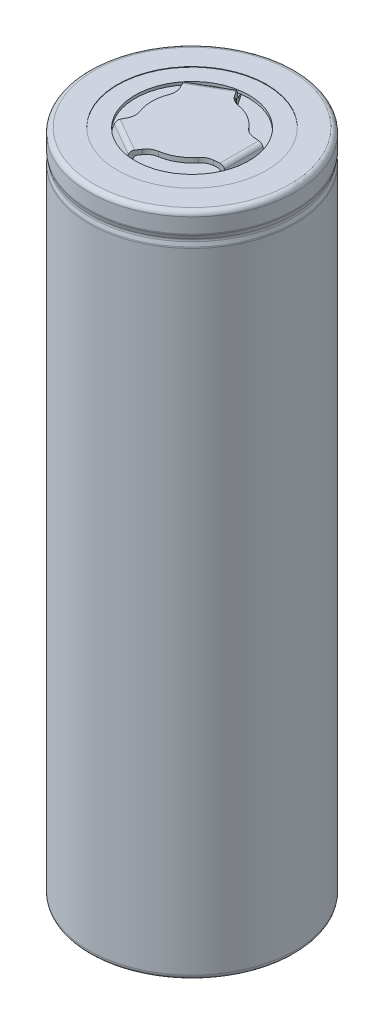
from build123d import *

# Parameters (mm, degrees)
SKETCH3_R           = 8
SKETCH3_R_2         = 6
BOSS_EXTRUDE1_DEPTH = 1
SKETCH5_R           = 4.25
BOSS_EXTRUDE3_DEPTH = 0.5
BOSS_EXTRUDE4_DEPTH = 1.75
BOSS_EXTRUDE5_START = 69.95
BOSS_EXTRUDE5_DEPTH = 0.5
DRAFT1_ANGLE        = 4
CIRPATTERN1_ANGLE   = 120
CIRPATTERN1_2_ANGLE = 120
FILLET1_R           = 1.5
SKETCH10_R          = 8
CUT_EXTRUDE1_DEPTH  = 0.7
SKETCH4_R           = 10.25
BOSS_EXTRUDE2_DEPTH = 68.7


with BuildPart() as part:
    # Sketch1 → Revolve1 (revolve)
    with BuildSketch(Plane.XY, mode=Mode.PRIVATE) as revolve1_sk:
        with BuildLine():
            Line((7.85, 70.2), (10.35, 70.2))
            ThreePointArc((10.35, 70.2), (10.703553391, 70.053553391), (10.85, 69.7))
            Line((10.85, 69.7), (10.85, 68.124220651))
            ThreePointArc((10.85, 68.124220651), (10.846117338, 68.062030724), (10.834529652, 68.000806647))
            Line((10.834529652, 68.000806647), (10.731434643, 67.596050404))
            ThreePointArc((10.731434643, 67.596050404), (10.715964295, 67.4726364), (10.731434643, 67.349222395))
            Line((10.731434643, 67.349222395), (10.834529652, 66.944466152))
            ThreePointArc((10.834529652, 66.944466152), (10.846117338, 66.883242075), (10.85, 66.821052148))
            Line((10.85, 66.821052148), (10.85, 0.5))
            ThreePointArc((10.85, 0.5), (10.703553391, 0.146446609), (10.35, 0))
            Line((10.35, 0), (8.5, 0))
            Line((8.5, 0), (8.5, 0.05))
            Line((8.5, 0.05), (10.35, 0.05))
            ThreePointArc((10.35, 0.05), (10.668198052, 0.181801948), (10.8, 0.5))
            Line((10.8, 0.5), (10.8, 66.821052148))
            ThreePointArc((10.8, 66.821052148), (10.796505604, 66.877023082), (10.786076687, 66.932124752))
            Line((10.786076687, 66.932124752), (10.682981678, 67.336880994))
            ThreePointArc((10.682981678, 67.336880994), (10.665964295, 67.4726364), (10.682981678, 67.608391805))
            Line((10.682981678, 67.608391805), (10.786076687, 68.013148047))
            ThreePointArc((10.786076687, 68.013148047), (10.796505604, 68.068249717), (10.8, 68.124220651))
            Line((10.8, 68.124220651), (10.8, 69.7))
            ThreePointArc((10.8, 69.7), (10.668198052, 70.018198052), (10.35, 70.15))
            Line((10.35, 70.15), (7.85, 70.15))
            Line((7.85, 70.15), (7.85, 70.2))
        make_face()
    revolve(revolve1_sk.sketch.rotate(Axis((0, 0, 0), (0, 1, 0)), 90), axis=Axis((0, 0, 0), (0, 1, 0)))


with BuildPart() as body_2:
    # Sketch3 → Boss-Extrude1 (new body)
    with BuildSketch(Plane(origin=(0, 70.15, 0), x_dir=(-1, 0, 0), z_dir=(0, -1, 0))):
        with Locations(Location((0, 0, 0), (0, 0, 90))):
            Circle(SKETCH3_R)
        with Locations(Location((0, 0, 0), (0, 0, 90))):
            Circle(SKETCH3_R_2, mode=Mode.SUBTRACT)
    extrude(amount=BOSS_EXTRUDE1_DEPTH)

    # Sketch10 → Cut-Extrude1 (cut)
    with BuildSketch(Plane.XZ.offset(-69.15)):
        with Locations(Location((0, 0, 0), (0, 0, 270))):
            Circle(SKETCH10_R)
    extrude(amount=-CUT_EXTRUDE1_DEPTH, mode=Mode.SUBTRACT)


with BuildPart() as body_3:
    # Sketch5 → Boss-Extrude3 (new body)
    with BuildSketch(Plane(origin=(0, 70.45, 0), x_dir=(1, 0, 0), z_dir=(0, 1, 0))):
        with Locations(Location((0, 0, 0), (0, 0, 270))):
            Circle(SKETCH5_R)
    extrude(amount=-BOSS_EXTRUDE3_DEPTH)


with BuildPart() as body_4:
    # Sketch6 → Boss-Extrude4 (new, symmetric)
    with BuildSketch(Plane.XY):
        with BuildLine():
            Line((4.75, 69.95), (4.811101977, 69.95))
            ThreePointArc((4.811101977, 69.95), (4.954496086, 69.904788011), (5.046025132, 69.785505036))
            Line((5.046025132, 69.785505036), (5.339572625, 68.978989928))
            ThreePointArc((5.339572625, 68.978989928), (5.522630717, 68.740423978), (5.809418935, 68.65))
            Line((5.809418935, 68.65), (9.407776856, 68.65))
            Line((9.407776856, 68.65), (9.407776856, 69.15))
            Line((9.407776856, 69.15), (6, 69.15))
            Line((6, 69.15), (5.98447082, 69.15))
            ThreePointArc((5.98447082, 69.15), (5.841076711, 69.195211989), (5.749547664, 69.314494964))
            Line((5.749547664, 69.314494964), (5.456000172, 70.121010072))
            ThreePointArc((5.456000172, 70.121010072), (5.27294208, 70.359576022), (4.986153861, 70.45))
            Line((4.986153861, 70.45), (4.75, 70.45))
            Line((4.75, 70.45), (4.75, 69.95))
        make_face()
    extrude(amount=BOSS_EXTRUDE4_DEPTH, both=True)

    # Boss-Extrude5: read off the stored shape, not the designer's step
    # Boss-Extrude5 outline → Boss-Extrude5 (add)
    with BuildSketch(Plane(origin=(0, 0, 0), x_dir=(1, 0, 0), z_dir=(0, 1, 0)).offset(BOSS_EXTRUDE5_START)):
        with BuildLine():
            Line((3.872983346, -1.75), (4.75, -1.75))
            Line((4.75, -1.75), (4.75, 1.75))
            Line((4.75, 1.75), (3.872983346, 1.75))
            ThreePointArc((3.872983346, 1.75), (4.25, 0), (3.872983346, -1.75))
        make_face()
    extrude(amount=BOSS_EXTRUDE5_DEPTH)

    # Draft1
    draft1_faces = [body_4.faces().sort_by_distance(p)[0] for p in [
        (4.342042661, 70.008201322, 1.75),
        (4.987878993, 69.952463743, -1.75),
    ]]
    draft(draft1_faces, Plane(origin=(9.407776856, 69.15, 1.75), x_dir=(0, 1, 0), z_dir=(1, 0, 0)), DRAFT1_ANGLE)


with BuildPart() as body_5:
    # CirPattern1: read off the stored shape, not the designer's step
    # CirPattern1: copy of body 4
    add(body_4.part.rotate(Axis((0, 0, 0), (0, -1, 0)), CIRPATTERN1_ANGLE))


with BuildPart() as body_6:
    # CirPattern1 2: copy of body 4
    add(body_4.part.rotate(Axis((0, 0, 0), (0, 1, 0)), CIRPATTERN1_2_ANGLE))


with BuildPart() as body_3_1:
    add(body_3.part)

    # Combine1: read off the stored shape, not the designer's step
    # Combine1: union body 4, body 5, body 6
    add(body_4.part)
    add(body_5.part)
    add(body_6.part)

    # Fillet1
    fillet1_edges = [body_3_1.edges().sort_by_distance(p)[0] for p in [
        (-3.695880575, 70.2, -2.098324755),
        (0.030737744, 70.2, -4.249888844),
        (-3.695880575, 70.2, 2.098324755),
        (0.030737744, 70.2, 4.249888844),
        (3.66514283, 70.2, 2.15156409),
        (3.66514283, 70.2, -2.15156409),
    ]]
    fillet(fillet1_edges, radius=FILLET1_R)


with BuildPart() as body_4_2:
    # Sketch4 → Boss-Extrude2 (new body)
    with BuildSketch(Plane(origin=(0, 0.05, 0), x_dir=(-1, 0, 0), z_dir=(0, -1, 0))):
        with Locations(Location((0, 0, 0), (0, 0, 90))):
            Circle(SKETCH4_R)
    extrude(amount=-BOSS_EXTRUDE2_DEPTH)


solid = Compound([part.part, body_2.part, body_3_1.part, body_4_2.part])
